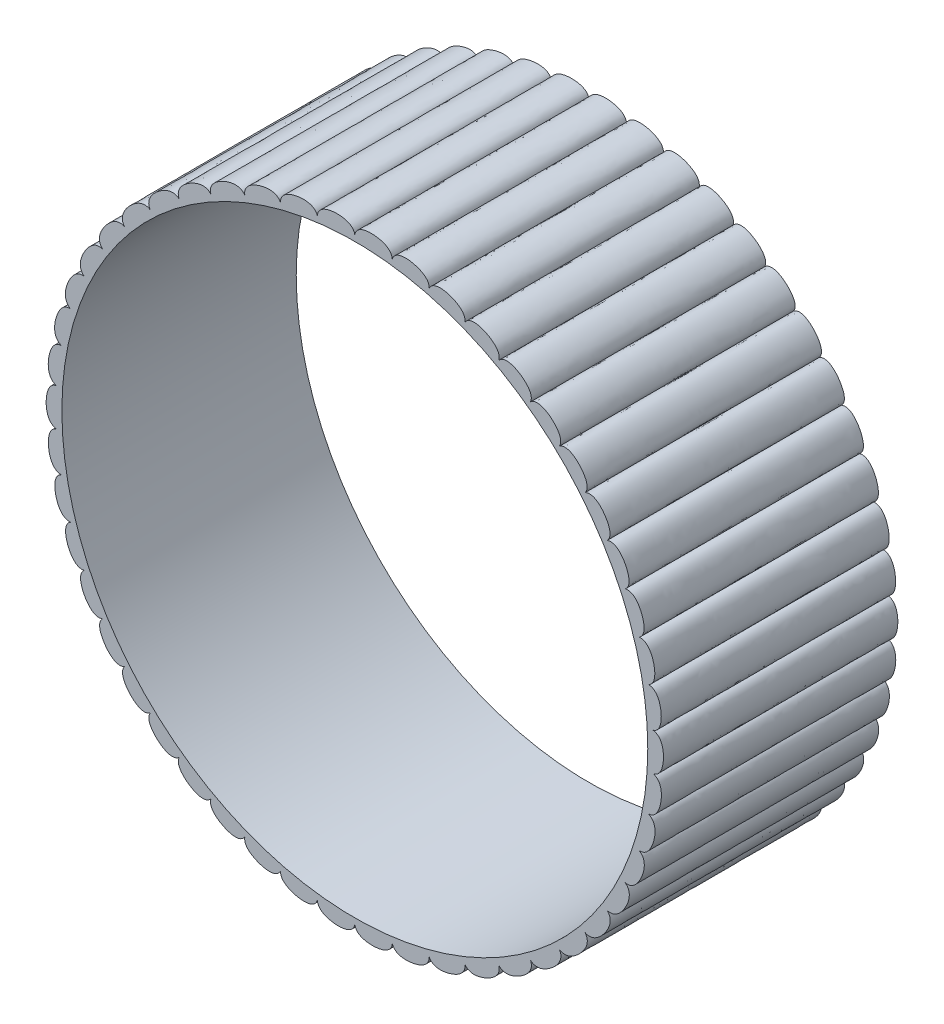
from build123d import *

# Parameters (mm, degrees)
SKETCH1_R           = 25
BOSS_EXTRUDE1_DEPTH = 20


with BuildPart() as part:
    # Sketch1 → Boss-Extrude1 (new body)
    with BuildSketch(Plane.XY):
        with BuildLine():
            add(Edge.make_bspline(
                [(0, 25.5), (0.123917372, 26.120226891), (0.946128365, 26.346108644), (2.407132086, 26.226362753), (3.148583131, 25.884279138), (3.195997456, 25.298924884)],
                knots=[0, 0, 0, 0, 0.438491403, 0.538491403, 1, 1, 1, 1], degree=3))
            add(Edge.make_bspline(
                [(-3.195997456, 25.298924884), (-3.150792252, 25.929792065), (-2.363375128, 26.256943035), (-0.898883718, 26.321253698), (-0.120404791, 26.074795971), (0, 25.5)],
                knots=[0, 0, 0, 0, 0.438491403, 0.538491403, 1, 1, 1, 1], degree=3))
            add(Edge.make_bspline(
                [(-6.341592123, 24.698870609), (-6.375811999, 25.330428929), (-5.635606783, 25.75368975), (-4.190723588, 26.001042747), (-3.387493857, 25.854097695), (-3.195997456, 25.298924884)],
                knots=[0, 0, 0, 0, 0.438491403, 0.538491403, 1, 1, 1, 1], degree=3))
            add(Edge.make_bspline(
                [(-9.387176093, 23.70930039), (-9.500281382, 24.331589796), (-8.818961553, 24.844285393), (-7.416473245, 25.270779821), (-6.601160121, 25.225664853), (-6.341592123, 24.698870609)],
                knots=[0, 0, 0, 0, 0.438491403, 0.538491403, 1, 1, 1, 1], degree=3))
            add(Edge.make_bspline(
                [(-12.28471869, 22.345820341), (-12.474925653, 22.949026958), (-11.863236031, 23.543071814), (-10.525260688, 24.141981601), (-9.710722146, 24.199408208), (-9.387176093, 23.70930039)],
                knots=[0, 0, 0, 0, 0.438491403, 0.538491403, 1, 1, 1, 1], degree=3))
            add(Edge.make_bspline(
                [(-14.988523933, 20.629933357), (-15.252832894, 21.204544255), (-14.72042019, 21.870569928), (-13.468058482, 22.632449909), (-12.667140283, 22.79151244), (-12.28471869, 22.345820341)],
                knots=[0, 0, 0, 0, 0.438491403, 0.538491403, 1, 1, 1, 1], degree=3))
            add(Edge.make_bspline(
                [(-17.455951201, 18.588699999), (-17.790193848, 19.125653223), (-17.345454529, 19.85315609), (-16.198456949, 20.765990962), (-15.42379005, 21.024180905), (-14.988523933, 20.629933357)],
                knots=[0, 0, 0, 0, 0.438491403, 0.538491403, 1, 1, 1, 1], degree=3))
            add(Edge.make_bspline(
                [(-19.648087691, 16.254311739), (-20.046992818, 16.745139214), (-19.696940689, 17.522646121), (-18.673396073, 18.572039932), (-17.937197434, 18.925285478), (-17.455951201, 18.588699999)],
                knots=[0, 0, 0, 0, 0.438491403, 0.538491403, 1, 1, 1, 1], degree=3))
            add(Edge.make_bspline(
                [(-21.5303621, 13.663583272), (-21.987638736, 14.100544357), (-21.737794327, 14.915793554), (-20.853844586, 16.085196739), (-20.1677245, 16.527926994), (-19.648087691, 16.254311739)],
                knots=[0, 0, 0, 0, 0.438491403, 0.538491403, 1, 1, 1, 1], degree=3))
            add(Edge.make_bspline(
                [(-23.073089838, 10.857371935), (-23.581526457, 11.233575491), (-23.435829963, 12.073710014), (-22.705415512, 13.344680384), (-22.080194503, 13.869913228), (-21.5303621, 13.663583272)],
                knots=[0, 0, 0, 0, 0.438491403, 0.538491403, 1, 1, 1, 1], degree=3))
            add(Edge.make_bspline(
                [(-24.251941166, 7.879933357), (-24.803519418, 8.18944643), (-24.764268561, 9.041216853), (-24.198908473, 10.393710448), (-23.644446648, 10.993162644), (-23.073089838, 10.857371935)],
                knots=[0, 0, 0, 0, 0.438491403, 0.538491403, 1, 1, 1, 1], degree=3))
            add(Edge.make_bspline(
                [(-25.048324894, 4.778223522), (-25.634346061, 5.016164906), (-25.70215985, 5.866138302), (-25.310770191, 7.278825489), (-24.835811746, 7.943043319), (-24.251941166, 7.879933357)],
                knots=[0, 0, 0, 0, 0.438491403, 0.538491403, 1, 1, 1, 1], degree=3))
            add(Edge.make_bspline(
                [(-25.449681575, 1.601158248), (-26.060903754, 1.763775466), (-26.234712725, 2.598547246), (-26.023465943, 4.049149104), (-25.635501255, 4.767657456), (-25.048324894, 4.778223522)],
                knots=[0, 0, 0, 0, 0.438491403, 0.538491403, 1, 1, 1, 1], degree=3))
            add(Edge.make_bspline(
                [(-25.449681575, -1.601158248), (-26.076465426, -1.516429768), (-26.353528508, -0.710024453), (-26.325756091, 0.755615218), (-26.030903596, 1.517082786), (-25.449681575, 1.601158248)],
                knots=[0, 0, 0, 0, 0.438491403, 0.538491403, 1, 1, 1, 1], degree=3))
            add(Edge.make_bspline(
                [(-25.048324894, -4.778223522), (-25.680785661, -4.772719998), (-26.056733404, -4.007398642), (-26.21287334, -2.54983517), (-26.015783038, -1.757417185), (-25.449681575, -1.601158248)],
                knots=[0, 0, 0, 0, 0.438491403, 0.538491403, 1, 1, 1, 1], degree=3))
            add(Edge.make_bspline(
                [(-24.251941166, -7.879933357), (-24.880104566, -7.953741582), (-25.349008048, -7.24157376), (-25.686597918, -5.815073135), (-25.590378039, -5.004201637), (-25.048324894, -4.778223522)],
                knots=[0, 0, 0, 0, 0.438491403, 0.538491403, 1, 1, 1, 1], degree=3))
            add(Edge.make_bspline(
                [(-23.073089838, -10.857371935), (-23.687049358, -11.009327911), (-24.241513693, -10.361544934), (-24.755229501, -8.988603923), (-24.761397492, -8.172066841), (-24.251941166, -7.879933357)],
                knots=[0, 0, 0, 0, 0.438491403, 0.538491403, 1, 1, 1, 1], degree=3))
            add(Edge.make_bspline(
                [(-21.5303621, -13.663583272), (-22.120435233, -13.891290562), (-22.751716186, -13.318108355), (-23.433456328, -12.020379057), (-23.541914915, -11.211053668), (-23.073089838, -10.857371935)],
                knots=[0, 0, 0, 0, 0.438491403, 0.538491403, 1, 1, 1, 1], degree=3))
            add(Edge.make_bspline(
                [(-19.648087691, -16.254311739), (-20.204968629, -16.554179262), (-20.903110523, -16.064637252), (-21.74212355, -14.862585633), (-21.951162277, -14.073235482), (-21.5303621, -13.663583272)],
                knots=[0, 0, 0, 0, 0.438491403, 0.538491403, 1, 1, 1, 1], degree=3))
            add(Edge.make_bspline(
                [(-17.455951201, -18.588699999), (-17.970857601, -18.955998667), (-18.72485032, -18.557817222), (-19.707904495, -17.470400355), (-20.014226696, -16.713473965), (-19.648087691, -16.254311739)],
                knots=[0, 0, 0, 0, 0.438491403, 0.538491403, 1, 1, 1, 1], degree=3))
            add(Edge.make_bspline(
                [(-14.988523933, -20.629933357), (-15.453335413, -21.058870648), (-16.251288042, -20.758329329), (-17.362880013, -19.802696427), (-17.761654804, -19.09013098), (-17.455951201, -18.588699999)],
                knots=[0, 0, 0, 0, 0.438491403, 0.538491403, 1, 1, 1, 1], degree=3))
            add(Edge.make_bspline(
                [(-12.28471869, -22.345820341), (-12.692104894, -22.82963166), (-13.521433244, -22.631470182), (-14.744032542, -21.822692147), (-15.228971006, -21.165725225), (-14.988523933, -20.629933357)],
                knots=[0, 0, 0, 0, 0.438491403, 0.538491403, 1, 1, 1, 1], degree=3))
            add(Edge.make_bspline(
                [(-9.387176093, -23.70930039), (-9.730712299, -24.240355742), (-10.578337366, -24.147699231), (-11.892662869, -23.498530976), (-12.456117238, -22.90752334), (-12.28471869, -22.345820341)],
                knots=[0, 0, 0, 0, 0.438491403, 0.538491403, 1, 1, 1, 1], degree=3))
            add(Edge.make_bspline(
                [(-6.341592123, -24.698870609), (-6.615860558, -25.268794934), (-7.468414788, -25.283104637), (-8.853738799, -24.803783934), (-9.48682306, -24.288056128), (-9.387176093, -23.70930039)],
                knots=[0, 0, 0, 0, 0.438491403, 0.538491403, 1, 1, 1, 1], degree=3))
            add(Edge.make_bspline(
                [(-3.195997456, -25.298924884), (-3.396672744, -25.898730135), (-4.240710848, -26.019780381), (-5.675185979, -25.717866402), (-6.367916015, -25.285551761), (-6.341592123, -24.698870609)],
                knots=[0, 0, 0, 0, 0.438491403, 0.538491403, 1, 1, 1, 1], degree=3))
            add(Edge.make_bspline(
                [(0, -25.5), (-0.123917372, -26.120226891), (-0.946128365, -26.346108644), (-2.407132086, -26.226362753), (-3.148583131, -25.884279138), (-3.195997456, -25.298924884)],
                knots=[0, 0, 0, 0, 0.438491403, 0.538491403, 1, 1, 1, 1], degree=3))
            add(Edge.make_bspline(
                [(3.195997456, -25.298924884), (3.150792252, -25.929792065), (2.363375128, -26.256943035), (0.898883718, -26.321253698), (0.120404791, -26.074795971), (0, -25.5)],
                knots=[0, 0, 0, 0, 0.438491403, 0.538491403, 1, 1, 1, 1], degree=3))
            add(Edge.make_bspline(
                [(6.341592123, -24.698870609), (6.375811999, -25.330428929), (5.635606783, -25.75368975), (4.190723588, -26.001042747), (3.387493857, -25.854097695), (3.195997456, -25.298924884)],
                knots=[0, 0, 0, 0, 0.438491403, 0.538491403, 1, 1, 1, 1], degree=3))
            add(Edge.make_bspline(
                [(9.387176093, -23.70930039), (9.500281382, -24.331589796), (8.818961553, -24.844285393), (7.416473245, -25.270779821), (6.601160121, -25.225664853), (6.341592123, -24.698870609)],
                knots=[0, 0, 0, 0, 0.438491403, 0.538491403, 1, 1, 1, 1], degree=3))
            add(Edge.make_bspline(
                [(12.28471869, -22.345820341), (12.474925653, -22.949026958), (11.863236031, -23.543071814), (10.525260688, -24.141981601), (9.710722146, -24.199408208), (9.387176093, -23.70930039)],
                knots=[0, 0, 0, 0, 0.438491403, 0.538491403, 1, 1, 1, 1], degree=3))
            add(Edge.make_bspline(
                [(14.988523933, -20.629933357), (15.252832894, -21.204544255), (14.72042019, -21.870569928), (13.468058482, -22.632449909), (12.667140283, -22.79151244), (12.28471869, -22.345820341)],
                knots=[0, 0, 0, 0, 0.438491403, 0.538491403, 1, 1, 1, 1], degree=3))
            add(Edge.make_bspline(
                [(17.455951201, -18.588699999), (17.790193848, -19.125653223), (17.345454529, -19.85315609), (16.198456949, -20.765990962), (15.42379005, -21.024180905), (14.988523933, -20.629933357)],
                knots=[0, 0, 0, 0, 0.438491403, 0.538491403, 1, 1, 1, 1], degree=3))
            add(Edge.make_bspline(
                [(19.648087691, -16.254311739), (20.046992818, -16.745139214), (19.696940689, -17.522646121), (18.673396073, -18.572039932), (17.937197434, -18.925285478), (17.455951201, -18.588699999)],
                knots=[0, 0, 0, 0, 0.438491403, 0.538491403, 1, 1, 1, 1], degree=3))
            add(Edge.make_bspline(
                [(21.5303621, -13.663583272), (21.987638736, -14.100544357), (21.737794327, -14.915793554), (20.853844586, -16.085196739), (20.1677245, -16.527926994), (19.648087691, -16.254311739)],
                knots=[0, 0, 0, 0, 0.438491403, 0.538491403, 1, 1, 1, 1], degree=3))
            add(Edge.make_bspline(
                [(23.073089838, -10.857371935), (23.581526457, -11.233575491), (23.435829963, -12.073710014), (22.705415512, -13.344680384), (22.080194503, -13.869913228), (21.5303621, -13.663583272)],
                knots=[0, 0, 0, 0, 0.438491403, 0.538491403, 1, 1, 1, 1], degree=3))
            add(Edge.make_bspline(
                [(24.251941166, -7.879933357), (24.803519418, -8.18944643), (24.764268561, -9.041216853), (24.198908473, -10.393710448), (23.644446648, -10.993162644), (23.073089838, -10.857371935)],
                knots=[0, 0, 0, 0, 0.438491403, 0.538491403, 1, 1, 1, 1], degree=3))
            add(Edge.make_bspline(
                [(25.048324894, -4.778223522), (25.634346061, -5.016164906), (25.70215985, -5.866138302), (25.310770191, -7.278825489), (24.835811746, -7.943043319), (24.251941166, -7.879933357)],
                knots=[0, 0, 0, 0, 0.438491403, 0.538491403, 1, 1, 1, 1], degree=3))
            add(Edge.make_bspline(
                [(25.449681575, -1.601158248), (26.060903754, -1.763775466), (26.234712725, -2.598547246), (26.023465943, -4.049149104), (25.635501255, -4.767657456), (25.048324894, -4.778223522)],
                knots=[0, 0, 0, 0, 0.438491403, 0.538491403, 1, 1, 1, 1], degree=3))
            add(Edge.make_bspline(
                [(25.449681575, 1.601158248), (26.076465426, 1.516429768), (26.353528508, 0.710024453), (26.325756091, -0.755615218), (26.030903596, -1.517082786), (25.449681575, -1.601158248)],
                knots=[0, 0, 0, 0, 0.438491403, 0.538491403, 1, 1, 1, 1], degree=3))
            add(Edge.make_bspline(
                [(25.048324894, 4.778223522), (25.680785661, 4.772719998), (26.056733404, 4.007398642), (26.21287334, 2.54983517), (26.015783038, 1.757417185), (25.449681575, 1.601158248)],
                knots=[0, 0, 0, 0, 0.438491403, 0.538491403, 1, 1, 1, 1], degree=3))
            add(Edge.make_bspline(
                [(24.251941166, 7.879933357), (24.880104566, 7.953741582), (25.349008048, 7.24157376), (25.686597918, 5.815073135), (25.590378039, 5.004201637), (25.048324894, 4.778223522)],
                knots=[0, 0, 0, 0, 0.438491403, 0.538491403, 1, 1, 1, 1], degree=3))
            add(Edge.make_bspline(
                [(23.073089838, 10.857371935), (23.687049358, 11.009327911), (24.241513693, 10.361544934), (24.755229501, 8.988603923), (24.761397492, 8.172066841), (24.251941166, 7.879933357)],
                knots=[0, 0, 0, 0, 0.438491403, 0.538491403, 1, 1, 1, 1], degree=3))
            add(Edge.make_bspline(
                [(21.5303621, 13.663583272), (22.120435233, 13.891290562), (22.751716186, 13.318108355), (23.433456328, 12.020379057), (23.541914915, 11.211053668), (23.073089838, 10.857371935)],
                knots=[0, 0, 0, 0, 0.438491403, 0.538491403, 1, 1, 1, 1], degree=3))
            add(Edge.make_bspline(
                [(19.648087691, 16.254311739), (20.204968629, 16.554179262), (20.903110523, 16.064637252), (21.74212355, 14.862585633), (21.951162277, 14.073235482), (21.5303621, 13.663583272)],
                knots=[0, 0, 0, 0, 0.438491403, 0.538491403, 1, 1, 1, 1], degree=3))
            add(Edge.make_bspline(
                [(17.455951201, 18.588699999), (17.970857601, 18.955998667), (18.72485032, 18.557817222), (19.707904495, 17.470400355), (20.014226696, 16.713473965), (19.648087691, 16.254311739)],
                knots=[0, 0, 0, 0, 0.438491403, 0.538491403, 1, 1, 1, 1], degree=3))
            add(Edge.make_bspline(
                [(14.988523933, 20.629933357), (15.453335413, 21.058870648), (16.251288042, 20.758329329), (17.362880013, 19.802696427), (17.761654804, 19.09013098), (17.455951201, 18.588699999)],
                knots=[0, 0, 0, 0, 0.438491403, 0.538491403, 1, 1, 1, 1], degree=3))
            add(Edge.make_bspline(
                [(12.28471869, 22.345820341), (12.692104894, 22.82963166), (13.521433244, 22.631470182), (14.744032542, 21.822692147), (15.228971006, 21.165725225), (14.988523933, 20.629933357)],
                knots=[0, 0, 0, 0, 0.438491403, 0.538491403, 1, 1, 1, 1], degree=3))
            add(Edge.make_bspline(
                [(9.387176093, 23.70930039), (9.730712299, 24.240355742), (10.578337366, 24.147699231), (11.892662869, 23.498530976), (12.456117238, 22.90752334), (12.28471869, 22.345820341)],
                knots=[0, 0, 0, 0, 0.438491403, 0.538491403, 1, 1, 1, 1], degree=3))
            add(Edge.make_bspline(
                [(6.341592123, 24.698870609), (6.615860558, 25.268794934), (7.468414788, 25.283104637), (8.853738799, 24.803783934), (9.48682306, 24.288056128), (9.387176093, 23.70930039)],
                knots=[0, 0, 0, 0, 0.438491403, 0.538491403, 1, 1, 1, 1], degree=3))
            add(Edge.make_bspline(
                [(3.195997456, 25.298924884), (3.396672744, 25.898730135), (4.240710848, 26.019780381), (5.675185979, 25.717866402), (6.367916015, 25.285551761), (6.341592123, 24.698870609)],
                knots=[0, 0, 0, 0, 0.438491403, 0.538491403, 1, 1, 1, 1], degree=3))
        make_face()
        Circle(SKETCH1_R, mode=Mode.SUBTRACT)
    extrude(amount=BOSS_EXTRUDE1_DEPTH)


solid = part.part
